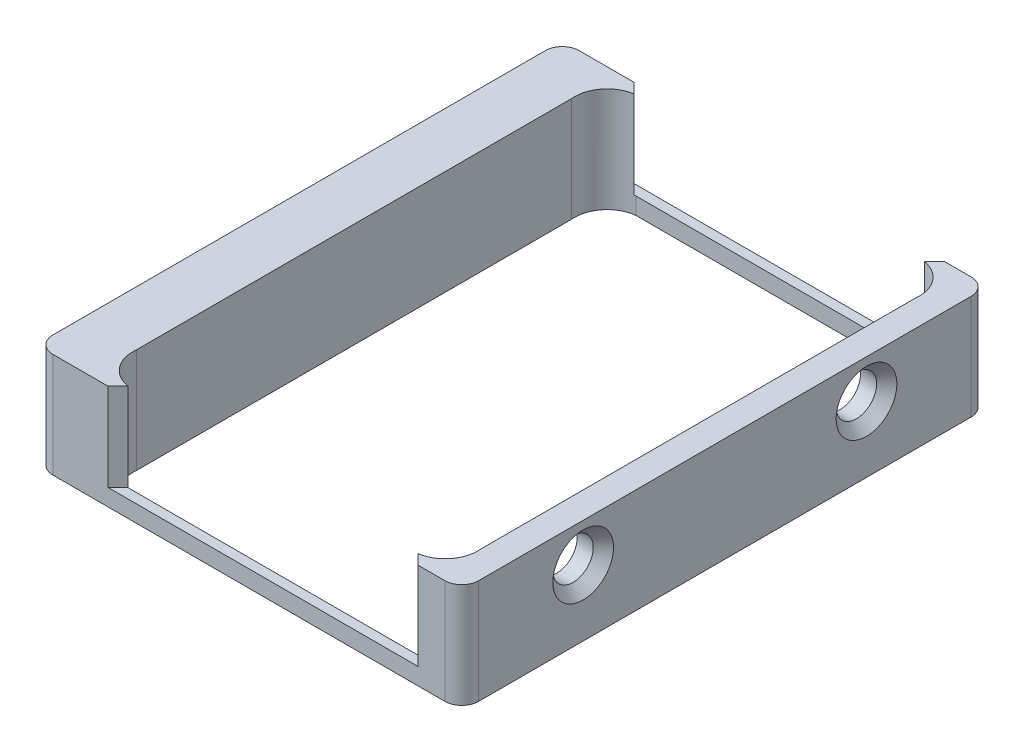
from build123d import *

# Parameters (mm, degrees)
SKETCH_1_W          = 126.2
SKETCH_1_H          = 156
EXTRUDE_1_DEPTH     = 31
CUT_EXTRUDE_1_DEPTH = 26
FILLET_1_R          = 5
F_12_0MM_1_D        = 12
F_12_0MM_1_DEPTH    = 17
F_12_0MM_1_TIP      = 3.605163714
SKETCH_6_R          = 2.1
CUT_EXTRUDE_2_DEPTH = 10
SKETCH_7_R          = 2.1
CUT_EXTRUDE_3_DEPTH = 10
CHAMFER_1_SIZE      = 3


with BuildPart() as part:
    # 草图1 → 凸台-拉伸1 (new body)
    with BuildSketch(Plane(origin=(0, 0, 0), x_dir=(1, 0, 0), z_dir=(0, 1, 0))):
        with Locations((-4.2, 0)):
            Rectangle(SKETCH_1_W, SKETCH_1_H)
        with BuildLine():
            Line((-42.5, 75.1), (42.5, 75.1))
            ThreePointArc((42.5, 75.1), (48.995331881, 71.581118318), (51.1, 64.5))
            Line((51.1, 64.5), (51.1, -64.5))
            ThreePointArc((51.1, -64.5), (48.995331881, -71.581118318), (42.5, -75.1))
            Line((42.5, -75.1), (-42.5, -75.1))
            ThreePointArc((-42.5, -75.1), (-48.995331881, -71.581118318), (-51.1, -64.5))
            Line((-51.1, -64.5), (-51.1, 64.5))
            ThreePointArc((-51.1, 64.5), (-48.995331881, 71.581118318), (-42.5, 75.1))
        make_face(mode=Mode.SUBTRACT)
    extrude(amount=EXTRUDE_1_DEPTH)

    # 草图2 → 切除-拉伸1 (cut)
    with BuildSketch(Plane(origin=(0, 31, 0), x_dir=(1, 0, 0), z_dir=(0, 1, 0))):
        Polygon((46, 78), (-46, 78), (-42.780928277, 74.780928277), (-42.5, 75.1), (42.5, 75.1), (42.872377268, 74.872377268), align=None)
        Polygon((42.872377268, -74.872377268), (42.5, -75.1), (-42.5, -75.1), (-42.780928277, -74.780928277), (-46, -78), (46, -78), align=None)
    extrude(amount=-CUT_EXTRUDE_1_DEPTH, mode=Mode.SUBTRACT)

    # 圆角1
    fillet_1_edges = [part.edges().sort_by_distance(p)[0] for p in [
        (-67.3, 15.5, -78),
        (58.9, 15.5, -78),
        (58.9, 15.5, 78),
        (-67.3, 15.5, 78),
    ]]
    fillet(fillet_1_edges, radius=FILLET_1_R)

    # Ø12.0mm 暗销孔1
    with Locations(Plane(origin=(58.9, 0, 0), x_dir=(0, 0, -1), z_dir=(1, 0, 0))):
        with Locations((42, 19.55), (-42, 19.55)):
            Hole(F_12_0MM_1_D / 2, depth=F_12_0MM_1_DEPTH)
            with Locations((0, 0, -(F_12_0MM_1_DEPTH + F_12_0MM_1_TIP / 2))):  # 118° drill point
                Cone(0, F_12_0MM_1_D / 2, F_12_0MM_1_TIP, mode=Mode.SUBTRACT)

    # 草图6 → 切除-拉伸2 (cut)
    with BuildSketch(Plane.ZY.offset(67.3)):
        with Locations((-11, 13.95)):
            Circle(SKETCH_6_R)
        with Locations((11, 13.95)):
            Circle(SKETCH_6_R)
    extrude(amount=-CUT_EXTRUDE_2_DEPTH, mode=Mode.SUBTRACT)

    # 草图7 → 切除-拉伸3 (cut)
    with BuildSketch(Plane.XZ):
        with Locations((-58.493442579, 70.964337058)):
            Circle(SKETCH_7_R)
        with Locations((53.705008218, 73.348219362)):
            Circle(SKETCH_7_R)
        with Locations((-58.493442579, -70.964337058)):
            Circle(SKETCH_7_R)
        with Locations((53.705008218, -73.348219362)):
            Circle(SKETCH_7_R)
    extrude(amount=-CUT_EXTRUDE_3_DEPTH, mode=Mode.SUBTRACT)

    # 倒角1
    chamfer_1_edges = [part.edges().sort_by_distance(p)[0] for p in [
        (58.9, 19.55, 36),
        (58.9, 19.55, -48),
    ]]
    chamfer(chamfer_1_edges, length=CHAMFER_1_SIZE)


solid = part.part
